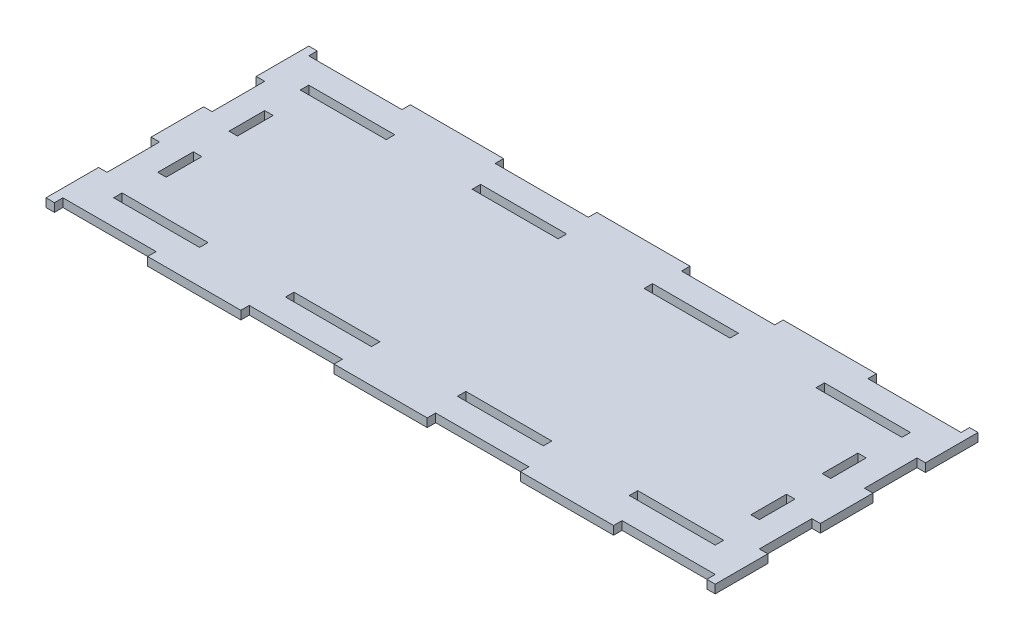
from build123d import *

# Parameters (mm, degrees)
SKETCH1_W           = 415
SKETCH1_H           = 126.5
BOSS_EXTRUDE1_DEPTH = 6
BOSS_EXTRUDE2_DEPTH = 6


with BuildPart() as part:
    # Sketch1 → Boss-Extrude1 (new body)
    with BuildSketch(Plane(origin=(0, 0, 0), x_dir=(1, 0, 0), z_dir=(0, 1, 0))):
        Rectangle(SKETCH1_W, SKETCH1_H)
    extrude(amount=BOSS_EXTRUDE1_DEPTH)

    # Sketch2 → Boss-Extrude2 (add)
    with BuildSketch(Plane(origin=(0, 6, 0), x_dir=(1, 0, 0), z_dir=(0, 1, 0))):
        Polygon((-231.5, -87.25), (231.5, -87.25), (231.5, 87.25), (165.357142857, 87.25), (165.357142857, 93.25), (99.214285714, 93.25), (99.214285714, 87.25), (33.071428571, 87.25), (33.071428571, 93.25), (-33.071428571, 93.25), (-33.071428571, 87.25), (-99.214285714, 87.25), (-99.214285714, 93.25), (-165.357142857, 93.25), (-165.357142857, 87.25), (-231.5, 87.25), (-231.5, 93.25), (-237.5, 93.25), (-237.5, 55.95), (-231.5, 55.95), (-231.5, 18.65), (-237.5, 18.65), (-237.5, -18.65), (-231.5, -18.65), (-231.5, -55.95), (-237.5, -55.95), (-237.5, -93.25), (-231.5, -93.25), align=None)
        Polygon((-207.5, -37.95), (-213.5, -37.95), (-213.5, -12.65), (-207.5, -12.65), (-207.5, 12.65), (-213.5, 12.65), (-213.5, 37.95), (-207.5, 37.95), (-207.5, 63.25), (-213.5, 63.25), (-213.5, 69.25), (-152.5, 69.25), (-152.5, 63.25), (-91.5, 63.25), (-91.5, 69.25), (-30.5, 69.25), (-30.5, 63.25), (30.5, 63.25), (30.5, 69.25), (91.5, 69.25), (91.5, 63.25), (152.5, 63.25), (152.5, 69.25), (213.5, 69.25), (213.5, -69.25), (-213.5, -69.25), (-213.5, -63.25), (-207.5, -63.25), align=None, mode=Mode.SUBTRACT)
    boss_extrude2 = extrude(amount=-BOSS_EXTRUDE2_DEPTH)

    # Mirror2: Boss-Extrude2 across plane
    add(boss_extrude2.mirror(Plane.XY))

    # Mirror3: Boss-Extrude2 across plane
    add(boss_extrude2.mirror(Plane(origin=(0, 0, 0), x_dir=(0, 0, 1), z_dir=(1, 0, 0))))


solid = part.part
